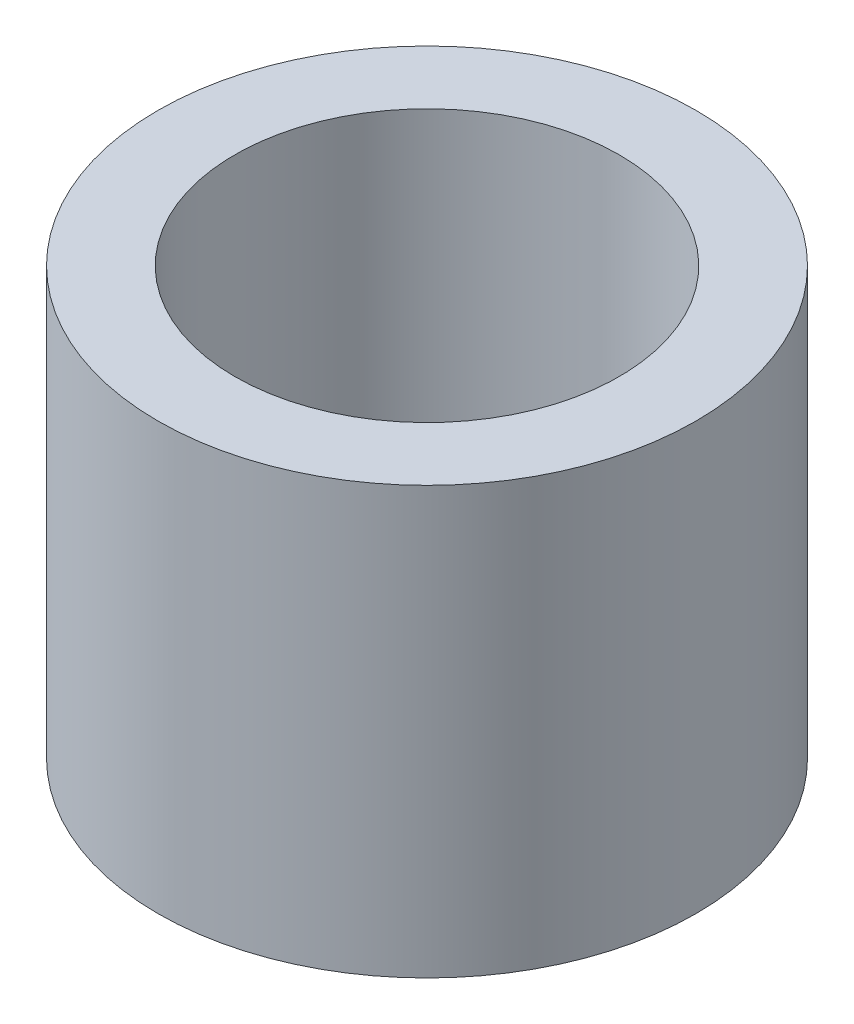
from build123d import *

# Parameters (mm, degrees)
SKETCH3_R           = 44.45
SKETCH3_R_2         = 31.75
BOSS_EXTRUDE1_DEPTH = 70.485


with BuildPart() as part:
    # Sketch3 → Boss-Extrude1 (new body)
    with BuildSketch(Plane(origin=(0, 0, 0), x_dir=(1, 0, 0), z_dir=(0, 1, 0))):
        Circle(SKETCH3_R)
        Circle(SKETCH3_R_2, mode=Mode.SUBTRACT)
    extrude(amount=BOSS_EXTRUDE1_DEPTH)


solid = part.part
